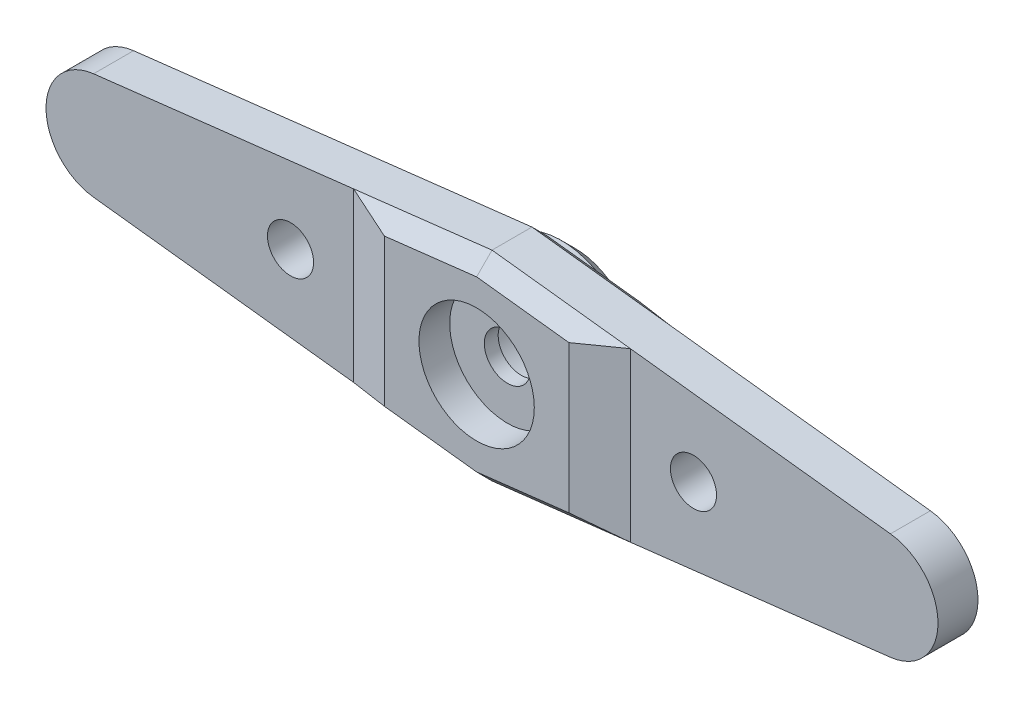
from build123d import *
from OCP.BRepFilletAPI import BRepFilletAPI_MakeChamfer

# Parameters (mm, degrees)
EXTRUDE_1_DEPTH     = 2.6
SKETCH_8_R          = 1.4999999999999987
CUT_EXTRUDE_4_DEPTH = 30.833035380262615
EXTRUDE_2_DEPTH     = 1
CHAMFER_1_SIZE      = 1
CHAMFER_2_SIZE      = 1
CHAMFER_2_SIZE_2    = 3
EXTRUDE_3_DEPTH     = 1
SKETCH_3_R          = 1.5
CUT_EXTRUDE_1_DEPTH = 31.073410182418638
SKETCH_4_R          = 3.75
CUT_EXTRUDE_2_DEPTH = 2
CHAMFER_3_SIZE      = 1
CHAMFER_4_SIZE      = 1
CHAMFER_4_SIZE_2    = 3
SKETCH_6_R          = 4.8
EXTRUDE_4_DEPTH     = 1.8000000000000007
CHAMFER_5_SIZE      = 0.9
SKETCH_7_R          = 2.9
CUT_EXTRUDE_3_DEPTH = 3.5


with BuildPart() as part:
    # ｽｹｯﾁ1 → ﾎﾞｽ - 押し出し1 (new body)
    with BuildSketch(Plane.XY):
        with BuildLine():
            Line((8e-16, 6.5), (25.905749403157248, 3.4764015046938295))
            ThreePointArc((25.905749403157248, 3.4764015046938295), (28.999999999999996, 6.4e-16), (25.905749403157248, -3.476401504693828))
            Line((25.905749403157248, -3.476401504693828), (8e-16, -6.5))
            Line((8e-16, -6.5), (-25.905749403157248, -3.476401504693854))
            ThreePointArc((-25.905749403157248, -3.476401504693854), (-29.000000000000018, -6.03e-15), (-25.905749403157248, 3.4764015046938423))
            Line((-25.905749403157248, 3.4764015046938423), (8e-16, 6.5))
        make_face()
    extrude(amount=EXTRUDE_1_DEPTH)

    # ｽｹｯﾁ8 → ｶｯﾄ - 押し出し4 (cut, through all)
    with BuildSketch(Plane.XY.offset(2.6)):
        with Locations((13.1, 0)):
            Circle(SKETCH_8_R)
        with Locations((-13.1, -1.6e-15)):
            Circle(SKETCH_8_R)
    extrude(amount=-CUT_EXTRUDE_4_DEPTH, mode=Mode.SUBTRACT)

    # ｽｹｯﾁ2 → ﾎﾞｽ - 押し出し2 (add)
    with BuildSketch(Plane.XY.offset(2.6)):
        Polygon((-9.000000000000002, 5.4495618893604005), (-9.000000000000002, -5.449561889360406), (8e-16, -6.5), (9, -5.4495618893604), (9, 5.449561889360396), (8e-16, 6.5), align=None)
    extrude(amount=EXTRUDE_2_DEPTH)

    # 面取り1
    chamfer_1_edges = [part.edges().sort_by_distance(p)[0] for p in [
        (4.500000000000001, -5.9747809446802, 3.6),
        (-4.500000000000001, -5.974780944680203, 3.6),
        (-4.5, 5.9747809446802, 3.6),
        (4.5, 5.974780944680198, 3.6),
    ]]
    chamfer(chamfer_1_edges, length=CHAMFER_1_SIZE)

    # 面取り2
    chamfer_2_edges_1 = [part.edges().sort_by_distance(p)[0] for p in [
        (9, 0, 3.6),
    ]]
    chamfer_2_side_1 = [part.faces().sort_by_distance(p)[0] for p in [
        (9, 0, 3.58),
    ]]
    chamfer_2_edges_2 = [part.edges().sort_by_distance(p)[0] for p in [
        (-9.000000000000002, -8.9e-16, 3.6),
    ]]
    chamfer_2_side_2 = [part.faces().sort_by_distance(p)[0] for p in [
        (-8.980000000000002, -8.9e-16, 3.6),
    ]]
    chamfer_2 = BRepFilletAPI_MakeChamfer(part.part.solid().wrapped)
    for e in chamfer_2_edges_1:
        chamfer_2.Add(CHAMFER_2_SIZE - 0.0001, CHAMFER_2_SIZE_2 - 0.0001, e.wrapped, chamfer_2_side_1[0].wrapped)
    for e in chamfer_2_edges_2:
        chamfer_2.Add(CHAMFER_2_SIZE_2 - 0.0001, CHAMFER_2_SIZE - 0.0001, e.wrapped, chamfer_2_side_2[0].wrapped)
    add(Compound.cast(chamfer_2.Shape()), mode=Mode.REPLACE)  # a hair under: the kernel refuses the full size

    # ｽｹｯﾁ5 → ﾎﾞｽ - 押し出し3 (add)
    with BuildSketch(Plane(origin=(0, 0, 0), x_dir=(-1, 0, 0), z_dir=(0, 0, -1))):
        Polygon((8.999999999999998, 5.449561889360397), (9, -5.449561889360403), (-8e-16, -6.5), (-9, -5.449561889360396), (-9, 5.449561889360396), (-8e-16, 6.5), align=None)
    extrude(amount=EXTRUDE_3_DEPTH)

    # ｽｹｯﾁ3 → ｶｯﾄ - 押し出し1 (cut, through all)
    with BuildSketch(Plane.XY.offset(3.6)):
        Circle(SKETCH_3_R)
    extrude(amount=-CUT_EXTRUDE_1_DEPTH, mode=Mode.SUBTRACT)

    # ｽｹｯﾁ4 → ｶｯﾄ - 押し出し2 (cut)
    with BuildSketch(Plane.XY.offset(3.6)):
        Circle(SKETCH_4_R)
    extrude(amount=-CUT_EXTRUDE_2_DEPTH, mode=Mode.SUBTRACT)

    # 面取り3
    chamfer_3_edges = [part.edges().sort_by_distance(p)[0] for p in [
        (-4.499999999999998, 5.974780944680198, -1),
        (4.5, 5.974780944680198, -1),
        (4.500000000000001, -5.974780944680198, -1),
        (-4.5, -5.974780944680202, -1),
    ]]
    chamfer(chamfer_3_edges, length=CHAMFER_3_SIZE)

    # 面取り4
    chamfer_4_edges_1 = [part.edges().sort_by_distance(p)[0] for p in [
        (9, 0, -1),
    ]]
    chamfer_4_side_1 = [part.faces().sort_by_distance(p)[0] for p in [
        (9, 0, -0.98),
    ]]
    chamfer_4_edges_2 = [part.edges().sort_by_distance(p)[0] for p in [
        (-8.999999999999998, -1.78e-15, -1),
    ]]
    chamfer_4_side_2 = [part.faces().sort_by_distance(p)[0] for p in [
        (-8.979999999999999, -1.78e-15, -1),
    ]]
    chamfer_4 = BRepFilletAPI_MakeChamfer(part.part.solid().wrapped)
    for e in chamfer_4_edges_1:
        chamfer_4.Add(CHAMFER_4_SIZE - 0.0001, CHAMFER_4_SIZE_2 - 0.0001, e.wrapped, chamfer_4_side_1[0].wrapped)
    for e in chamfer_4_edges_2:
        chamfer_4.Add(CHAMFER_4_SIZE_2 - 0.0001, CHAMFER_4_SIZE - 0.0001, e.wrapped, chamfer_4_side_2[0].wrapped)
    add(Compound.cast(chamfer_4.Shape()), mode=Mode.REPLACE)  # a hair under: the kernel refuses the full size

    # ｽｹｯﾁ6 → ﾎﾞｽ - 押し出し4 (add)
    with BuildSketch(Plane(origin=(0, 0, -1), x_dir=(-1, 0, 0), z_dir=(0, 0, -1))):
        Circle(SKETCH_6_R)
    extrude(amount=EXTRUDE_4_DEPTH)

    # 面取り5
    chamfer_5_edges = [part.edges().sort_by_distance(p)[0] for p in [
        (4.800000000000001, -2.88e-15, -2.8000000000000007),
    ]]
    chamfer(chamfer_5_edges, length=CHAMFER_5_SIZE)

    # ｽｹｯﾁ7 → ｶｯﾄ - 押し出し3 (cut)
    with BuildSketch(Plane(origin=(0, 0, -2.8000000000000007), x_dir=(-1, 0, 0), z_dir=(0, 0, -1))):
        Circle(SKETCH_7_R)
    extrude(amount=-CUT_EXTRUDE_3_DEPTH, mode=Mode.SUBTRACT)


solid = part.part
